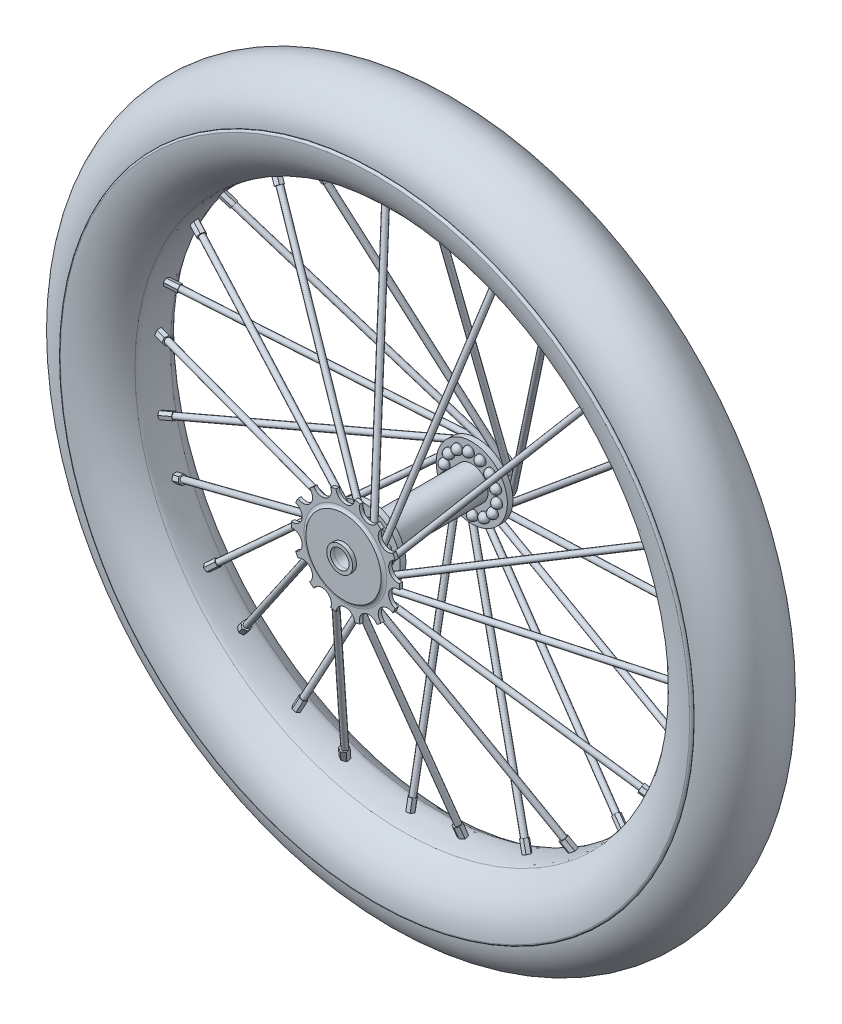
from build123d import *

# Parameters (mm, degrees)
BOSS_EXTRUDE1_DEPTH      = 38.1
BOSS_EXTRUDE1_DEPTH_BACK = 38.1
SKETCH2_R                = 8.89
SKETCH2_R_2              = 5.08
SKETCH3_R                = 5.08
BOSS_EXTRUDE2_DEPTH      = 3.81
SKETCH4_R                = 11.43
SKETCH4_R_2              = 5.08
BOSS_EXTRUDE3_DEPTH      = 3.81
SKETCH5_R                = 10.16
SKETCH5_R_2              = 5.08
BOSS_EXTRUDE4_DEPTH      = 3.81
FILLET1_R                = 2.54
SKETCH6_W                = 14.160332243
SKETCH6_H                = 3.048
SKETCH7_R                = 6.985
SKETCH7_R_2              = 5.08
BOSS_EXTRUDE5_DEPTH      = 2.032
SKETCH8_R                = 6.985
SKETCH8_R_2              = 5.08
BOSS_EXTRUDE6_DEPTH      = 6.35
SKETCH9_R                = 1.524
BOSS_EXTRUDE7_REACH      = 283.42
SKETCH10_R               = 2.54
BOSS_EXTRUDE8_DEPTH      = 6.35
CIRPATTERN1_COUNT        = 14
FILLET2_R                = 2.54
SKETCH12_R               = 1.524
BOSS_EXTRUDE10_REACH     = 283.544
SKETCH14_R               = 2.54
FILLET3_R                = 2.54
BOSS_EXTRUDE12_DEPTH     = 6.35
CIRPATTERN3_COUNT        = 14
FILLET3_OF_CIRPATTERN3_R = 2.54
SKETCH16_R               = 37.893444866
SKETCH16_R_2             = 20.32
CUT_EXTRUDE1_DEPTH       = 1.016
FILLET4_R                = 2.54
SKETCH17_R               = 37.893444866
SKETCH17_R_2             = 20.32
CUT_EXTRUDE2_DEPTH       = 1.016
FILLET5_R                = 2.54


# Some blends are built 0.0001 mm under size
with BuildPart() as part:
    # Sketch1 → Revolve1 (revolve)
    with BuildSketch(Plane(origin=(0, 0, 0), x_dir=(0, 0, -1), z_dir=(1, 0, 0)), mode=Mode.PRIVATE) as revolve1_sk:
        with BuildLine():
            ThreePointArc((-22.86, 170.18), (0, 193.04), (22.86, 170.18))
            ThreePointArc((22.86, 170.18), (23.876, 171.196), (24.892, 170.18))
            add(Edge.make_bspline(
                [(24.892, 170.18), (24.653803043, 159.198206923), (19.56957068, 150.819658721), (9.639302913, 145.044355395)],
                knots=[0, 0, 0, 0, 1, 1, 1, 1], degree=3))
            add(Edge.make_bspline(
                [(-9.639302913, 145.044355395), (-7.083077049, 143.557690576), (7.062484805, 143.545714418), (9.639302913, 145.044355395)],
                knots=[0, 0, 0, 0, 1, 1, 1, 1], degree=3))
            add(Edge.make_bspline(
                [(-24.892, 170.18), (-24.653803043, 159.198206923), (-19.56957068, 150.819658721), (-9.639302913, 145.044355395)],
                knots=[0, 0, 0, 0, 1, 1, 1, 1], degree=3))
            ThreePointArc((-24.892, 170.18), (-23.876, 171.196), (-22.86, 170.18))
        make_face()
    revolve(revolve1_sk.sketch.rotate(Axis((0, 0, 0), (0, 0, -1)), 90), axis=Axis((0, 0, 0), (0, 0, -1)))



with BuildPart() as body_2:
    # Sketch2 → Boss-Extrude1 (new, two sides: drawn at the far end of the back side and taken through both)
    with BuildSketch(Plane.XY.offset(-BOSS_EXTRUDE1_DEPTH_BACK)):
        Circle(SKETCH2_R)
        Circle(SKETCH2_R_2, mode=Mode.SUBTRACT)
    extrude(amount=BOSS_EXTRUDE1_DEPTH + BOSS_EXTRUDE1_DEPTH_BACK)

    # Sketch3 → Boss-Extrude2 (add)
    with BuildSketch(Plane.XY.offset(38.1)):
        with BuildLine():
            Line((5.060757507, -28.76826087), (7.922495633, -28.115087817))
            ThreePointArc((7.922495633, -28.115087817), (10.469614625, -21.740378782), (17.041665555, -23.723527037))
            ThreePointArc((17.041665555, -23.723527037), (18.212137112, -22.837297603), (19.336601349, -21.893376813))
            ThreePointArc((19.336601349, -21.893376813), (18.865593672, -15.044808919), (25.647262739, -13.980057726))
            ThreePointArc((25.647262739, -13.980057726), (26.317300631, -12.67374402), (26.92085602, -11.335414027))
            ThreePointArc((26.92085602, -11.335414027), (23.525010521, -5.369430136), (29.173104994, -1.467666527))
            ThreePointArc((29.173104994, -1.467666527), (29.21, 0), (29.173104994, 1.467666527))
            ThreePointArc((29.173104994, 1.467666527), (23.525010521, 5.369430136), (26.92085602, 11.335414027))
            ThreePointArc((26.92085602, 11.335414027), (26.317300631, 12.67374402), (25.647262739, 13.980057726))
            ThreePointArc((25.647262739, 13.980057726), (18.865593672, 15.044808919), (19.336601349, 21.893376813))
            ThreePointArc((19.336601349, 21.893376813), (18.212137112, 22.837297603), (17.041665555, 23.723527037))
            ThreePointArc((17.041665555, 23.723527037), (10.469614625, 21.740378782), (7.922495633, 28.115087817))
            ThreePointArc((7.922495633, 28.115087817), (6.499836481, 28.477644315), (5.060757507, 28.76826087))
            ThreePointArc((5.060757507, 28.76826087), (0, 24.13), (-5.060757507, 28.76826087))
            ThreePointArc((-5.060757507, 28.76826087), (-6.499836481, 28.477644315), (-7.922495633, 28.115087817))
            ThreePointArc((-7.922495633, 28.115087817), (-10.469614625, 21.740378782), (-17.041665555, 23.723527037))
            ThreePointArc((-17.041665555, 23.723527037), (-18.212137112, 22.837297603), (-19.336601349, 21.893376813))
            ThreePointArc((-19.336601349, 21.893376813), (-18.865593672, 15.044808919), (-25.647262739, 13.980057726))
            ThreePointArc((-25.647262739, 13.980057726), (-26.317300631, 12.67374402), (-26.92085602, 11.335414027))
            ThreePointArc((-26.92085602, 11.335414027), (-23.525010521, 5.369430136), (-29.173104994, 1.467666527))
            ThreePointArc((-29.173104994, 1.467666527), (-29.21, 0), (-29.173104994, -1.467666527))
            ThreePointArc((-29.173104994, -1.467666527), (-23.525010521, -5.369430136), (-26.92085602, -11.335414027))
            ThreePointArc((-26.92085602, -11.335414027), (-26.317300631, -12.67374402), (-25.647262739, -13.980057726))
            ThreePointArc((-25.647262739, -13.980057726), (-18.865593672, -15.044808919), (-19.336601349, -21.893376813))
            ThreePointArc((-19.336601349, -21.893376813), (-18.212137112, -22.837297603), (-17.041665555, -23.723527037))
            ThreePointArc((-17.041665555, -23.723527037), (-10.469614625, -21.740378782), (-7.922495633, -28.115087817))
            ThreePointArc((-7.922495633, -28.115087817), (-6.499836481, -28.477644315), (-5.060757507, -28.76826087))
            ThreePointArc((-5.060757507, -28.76826087), (0, -24.13), (5.060757507, -28.76826087))
        make_face()
        Circle(SKETCH3_R, mode=Mode.SUBTRACT)
    extrude(amount=BOSS_EXTRUDE2_DEPTH)

    # Sketch4 → Boss-Extrude3 (add)
    with BuildSketch(Plane(origin=(0, 0, 38.1), x_dir=(-1, 0, 0), z_dir=(0, 0, -1))):
        with Locations(Location((0, 0, 0), (0, 0, 180))):
            Circle(SKETCH4_R)
        with Locations(Location((0, 0, 0), (0, 0, 180))):
            Circle(SKETCH4_R_2, mode=Mode.SUBTRACT)
    boss_extrude3 = extrude(amount=BOSS_EXTRUDE3_DEPTH)

    # Sketch5 → Boss-Extrude4 (add)
    with BuildSketch(Plane(origin=(0, 0, 34.29), x_dir=(-1, 0, 0), z_dir=(0, 0, -1))):
        with Locations(Location((0, 0, 0), (0, 0, 180))):
            Circle(SKETCH5_R)
        with Locations(Location((0, 0, 0), (0, 0, 180))):
            Circle(SKETCH5_R_2, mode=Mode.SUBTRACT)
    boss_extrude4 = extrude(amount=BOSS_EXTRUDE4_DEPTH)

    # Mirror1: Boss-Extrude3, Boss-Extrude4 across plane
    add(boss_extrude3.mirror(Plane.XY))
    add(boss_extrude4.mirror(Plane.XY))

    # Fillet1
    # the kernel refuses this fillet: 2.54 mm, written as the material it adds along each edge
    with BuildSketch(Plane(origin=(0, 0, -34.29), x_dir=(1, 0, 0), z_dir=(0, 1, 0))) as fillet1_piece_1:
        with BuildLine():
            CenterArc((12.7, -2.199704526), FILLET1_R, 120, 60)
            Line((11.43, 0), (11.4046, 0.043994091))
            ThreePointArc((11.4046, 0.043994091), (10.795, 0.0508), (10.16, 0.0508))
            Line((10.16, 0.0508), (10.1092, 0))
            Line((10.1092, 0), (10.1092, -2.199704526))
            Line((10.1092, -2.199704526), (10.16, -2.199704526))
        make_face()
    revolve(axis=Axis((0, 0, -34.29), (0, 0, -1)))
    with BuildSketch(Plane(origin=(0, 0, 34.29), x_dir=(1, 0, 0), z_dir=(0, 1, 0))) as fillet1_piece_2:
        with BuildLine():
            CenterArc((12.7, 2.199704526), FILLET1_R, 180, 60)
            Line((11.43, 0), (11.4046, -0.043994091))
            ThreePointArc((11.4046, -0.043994091), (10.795, -0.0508), (10.16, -0.0508))
            Line((10.16, -0.0508), (10.1092, 0))
            Line((10.1092, 0), (10.1092, 2.199704526))
            Line((10.1092, 2.199704526), (10.16, 2.199704526))
        make_face()
    revolve(axis=Axis((0, 0, 34.29), (0, 0, -1)))

    # Sketch6 → Revolve2 (revolve)
    with BuildSketch(Plane(origin=(0, 0, 0), x_dir=(1, 0, 0), z_dir=(0, 1, 0))):
        with Locations((-12.160166122, 28.956)):
            Rectangle(SKETCH6_W, SKETCH6_H)
        with Locations((-12.160166122, -28.956)):
            Rectangle(SKETCH6_W, SKETCH6_H)
    revolve(axis=Axis((0, 0, -38.1), (0, 0, 1)))


with BuildPart() as body_3:
    # Sketch7 → Boss-Extrude5 (new body)
    with BuildSketch(Plane.XY.offset(41.91)):
        Circle(SKETCH7_R)
        Circle(SKETCH7_R_2, mode=Mode.SUBTRACT)
    extrude(amount=BOSS_EXTRUDE5_DEPTH)


with BuildPart() as body_4:
    # Sketch8 → Boss-Extrude6 (new body)
    with BuildSketch(Plane(origin=(0, 0, -38.1), x_dir=(-1, 0, 0), z_dir=(0, 0, -1))):
        Circle(SKETCH8_R)
        Circle(SKETCH8_R_2, mode=Mode.SUBTRACT)
    extrude(amount=BOSS_EXTRUDE6_DEPTH)


with BuildPart() as part_1:
    add(part.part)

    add(body_2.part)  # Sweep1 merges body 2
    # Sweep1: sweep along a curve in space
    with BuildLine() as sweep1_path:
        Line((-4.843776069, 14.957865584, -34.126089018), (-138.745661837, 38.278047733, -0.782106505))
        ThreePointArc((-4.843776069, 14.957865584, -34.126089018), (-2.275159795, 14.510518641, -33.564180716), (-1.125527161, 14.310300083, -31.165867325))
        Line((-1.125527161, 14.310300083, -27.432), (-1.125527161, 14.310300083, -31.165867325))
        Line((-1.125527161, 14.310300083, -27.432), (-1.125527161, 14.310300083, -24.384))
    # Sketch9 → Sweep1 (sweep)
    with BuildSketch(Plane(origin=(-138.745661837, 38.278047733, -0.782106505), x_dir=(0.23472706741246765, -0.0408797675689433, 0.9712013428879988), z_dir=(-0.9567992703776121, 0.1666349442113543, 0.23826026016217636))):
        Circle(SKETCH9_R)
    sweep1 = sweep(path=sweep1_path.line)

    # Sketch10 → Boss-Extrude7 (add, up to next)
    with BuildSketch(Plane.XY.offset(-24.384), mode=Mode.PRIVATE) as boss_extrude7_sk1:
        with Locations((-1.125527161, 14.310300083)):
            Circle(SKETCH10_R)
    boss_extrude7_tool1 = extrude(boss_extrude7_sk1.sketch, amount=-BOSS_EXTRUDE7_REACH, mode=Mode.PRIVATE) - part_1.part
    boss_extrude7 = boss_extrude7_tool1.solids().sort_by_distance((-1.125527, 14.3103, -24.384))[0]
    add(boss_extrude7)


with BuildPart() as body_4_2:
    # Sketch11 → Boss-Extrude8 (new body)
    with BuildSketch(Plane(origin=(-138.745661837, 38.278047733, -0.782106505), x_dir=(0.23472706741246765, -0.0408797675689433, 0.9712013428879988), z_dir=(-0.9567992703776121, 0.1666349442113543, 0.23826026016217636))):
        Polygon((-0.340783466, -2.003220065), (1.564447733, -1.296737171), (1.905231199, 0.706482894), (0.340783466, 2.003220065), (-1.564447733, 1.296737171), (-1.905231199, -0.706482894), align=None)
    boss_extrude8 = extrude(amount=-BOSS_EXTRUDE8_DEPTH)


with BuildPart() as part_2:
    add(part_1.part)

    # CirPattern1: Sweep1, Boss-Extrude7, Boss-Extrude8 ×14 about axis
    cirpattern1_axis = Axis((0, 0, 0), (0, 0, 1))
    add([sweep1.rotate(cirpattern1_axis, i * 360 / CIRPATTERN1_COUNT) for i in range(1, CIRPATTERN1_COUNT)])
    add([boss_extrude7.rotate(cirpattern1_axis, i * 360 / CIRPATTERN1_COUNT) for i in range(1, CIRPATTERN1_COUNT)])
    add([boss_extrude8.rotate(cirpattern1_axis, i * 360 / CIRPATTERN1_COUNT) for i in range(1, CIRPATTERN1_COUNT)])

    # Fillet2
    fillet2_edges = [part_2.edges().sort_by_distance(p)[0] for p in [
        (14.76716751, 0.389283402, -24.384),
        (13.473661931, -6.056501629, -24.384),
        (9.511532364, -11.302722235, -24.384),
        (3.665527161, -14.310300083, -24.384),
        (-2.906480652, -14.483547495, -24.384),
        (-8.902824325, -11.788150697, -24.384),
        (-13.135854455, -6.757966081, -24.384),
        (-14.76716751, -0.389283402, -24.384),
        (-13.473661931, 6.056501629, -24.384),
        (-9.511532364, 11.302722235, -24.384),
        (-3.665527161, 14.310300083, -24.384),
        (2.906480652, 14.483547495, -24.384),
        (8.902824325, 11.788150697, -24.384),
        (13.135854455, 6.757966081, -24.384),
    ]]
    fillet(fillet2_edges, radius=FILLET2_R - 0.0001)  # a hair under: the kernel refuses the full size

    # Sweep3: sweep along a curve in space
    with BuildLine() as sweep3_path:
        Line((13.813011478, 9.061857251, 33.994717988), (42.977234575, 137.391375094, -2.105123238))
        ThreePointArc((12.958857902, 5.30337837, 31.055302978), (13.22471615, 6.473217894, 33.478931582), (13.813011478, 9.061857251, 33.994717988))
        Line((12.958857902, 5.30337837, 27.432), (12.958857902, 5.30337837, 31.055302978))
        Line((12.958857902, 5.30337837, 27.432), (12.958857902, 5.30337837, 24.384))
    # Sketch12 → Sweep3 (sweep)
    with BuildSketch(Plane(origin=(42.977234575, 137.391375094, -2.105123238), x_dir=(0.9768674105714977, -0.20779848196263315, 0.05049606972193202), z_dir=(0.21371486792608066, 0.9403962473294285, -0.26453894464911265))):
        Circle(SKETCH12_R)
    sweep3 = sweep(path=sweep3_path.line)

    # Sketch14 → Boss-Extrude10 (add, up to next)
    with BuildSketch(Plane(origin=(0, 0, 24.384), x_dir=(-1, 0, 0), z_dir=(0, 0, -1)), mode=Mode.PRIVATE) as boss_extrude10_sk1:
        with Locations(Location((-12.958857902, 5.30337837, 0), (0, 0, 90))):
            Circle(SKETCH14_R)
    boss_extrude10_tool1 = extrude(boss_extrude10_sk1.sketch, amount=-BOSS_EXTRUDE10_REACH, mode=Mode.PRIVATE) - part_2.part
    boss_extrude10 = boss_extrude10_tool1.solids().sort_by_distance((12.958858, 5.303378, 24.384))[0]
    add(boss_extrude10)

    # Fillet3
    fillet3_edges = [part_2.edges().sort_by_distance(p)[0] for p in [
        (12.958857902, 2.76337837, 24.384),
    ]]
    fillet(fillet3_edges, radius=FILLET3_R)

    # Sketch15 → Boss-Extrude12 (add)
    with BuildSketch(Plane(origin=(42.977234575, 137.391375094, -2.105123238), x_dir=(0.9768674105714977, -0.20779848196263315, 0.05049606972193202), z_dir=(0.21371486792608066, 0.9403962473294285, -0.26453894464911265))):
        Polygon((-1.964597547, -1.283816425), (-0.016390643, -2.505370139), (2.015609357, -1.428950325), (2.099402453, 0.869023203), (0.151195549, 2.090576916), (-1.880804451, 1.014157102), align=None)
    boss_extrude12 = extrude(amount=-BOSS_EXTRUDE12_DEPTH)

    # CirPattern3: Sweep3, Boss-Extrude10, Boss-Extrude12 ×14 about axis
    cirpattern3_axis = Axis((0, 0, 0), (0, 0, 1))
    add([sweep3.rotate(cirpattern3_axis, i * 360 / CIRPATTERN3_COUNT) for i in range(1, CIRPATTERN3_COUNT)])
    add([boss_extrude10.rotate(cirpattern3_axis, i * 360 / CIRPATTERN3_COUNT) for i in range(1, CIRPATTERN3_COUNT)])
    add([boss_extrude12.rotate(cirpattern3_axis, i * 360 / CIRPATTERN3_COUNT) for i in range(1, CIRPATTERN3_COUNT)])

    # Fillet3 of CirPattern3
    fillet3_of_cirpattern3_edges = [part_2.edges().sort_by_distance(p)[0] for p in [
        (10.476542593, 8.112355602, 24.384),
        (5.919219538, 11.854581316, 24.384),
        (0.189522459, 13.248861814, 24.384),
        (-5.577711868, 12.019042743, 24.384),
        (-10.240211953, 8.408704852, 24.384),
        (-12.874512473, 3.13291984, 24.384),
        (-12.958857902, -2.76337837, 24.384),
        (-10.476542593, -8.112355602, 24.384),
        (-5.919219538, -11.854581316, 24.384),
        (-0.189522459, -13.248861814, 24.384),
        (5.577711868, -12.019042743, 24.384),
        (10.240211953, -8.408704852, 24.384),
        (12.874512473, -3.13291984, 24.384),
    ]]
    fillet(fillet3_of_cirpattern3_edges, radius=FILLET3_OF_CIRPATTERN3_R)

    # Sketch16 → Cut-Extrude1 (cut)
    with BuildSketch(Plane.XY.offset(41.91)):
        Circle(SKETCH16_R)
        Circle(SKETCH16_R_2, mode=Mode.SUBTRACT)
    extrude(amount=-CUT_EXTRUDE1_DEPTH, mode=Mode.SUBTRACT)

    # Fillet4
    # the kernel refuses this fillet: 2.54 mm, written as the material it adds along each edge
    with BuildSketch(Plane(origin=(0, 0, 40.894), x_dir=(1, 0, 0), z_dir=(0, -1, 0))) as fillet4_piece_1:
        with BuildLine():
            CenterArc((22.352, 2.54), FILLET4_R, 216.869897646, 53.130102354)
            Line((20.32, 1.016), (20.27936, 0.98552))
            ThreePointArc((20.27936, 0.98552), (20.2692, 0.508), (20.2692, 0))
            Line((20.2692, 0), (20.32, -0.0508))
            Line((20.32, -0.0508), (22.352, -0.0508))
            Line((22.352, -0.0508), (22.352, 0))
        make_face()
    revolve(axis=Axis((0, 0, 40.894), (0, 0, 1)))

    # Sketch17 → Cut-Extrude2 (cut)
    with BuildSketch(Plane(origin=(0, 0, 38.1), x_dir=(-1, 0, 0), z_dir=(0, 0, -1))):
        Circle(SKETCH17_R)
        Circle(SKETCH17_R_2, mode=Mode.SUBTRACT)
    extrude(amount=-CUT_EXTRUDE2_DEPTH, mode=Mode.SUBTRACT)

    # Fillet5
    # the kernel refuses this fillet: 2.54 mm, written as the material it takes off along each edge
    with BuildSketch(Plane(origin=(0, 0, 38.1), x_dir=(-1, 0, 0), z_dir=(0, -1, 0))) as fillet5_piece_1:
        with BuildLine():
            CenterArc((18.288, -2.54), FILLET5_R, 36.869897646, 53.130102354)
            Line((18.288, 0), (18.288, 0.0508))
            Line((18.288, 0.0508), (20.32, 0.0508))
            Line((20.32, 0.0508), (20.3708, 0))
            ThreePointArc((20.3708, 0), (20.3708, -0.508), (20.36064, -0.98552))
            Line((20.36064, -0.98552), (20.32, -1.016))
        make_face()
    revolve(axis=Axis((0, 0, 38.1), (0, 0, -1)), mode=Mode.SUBTRACT)


solid = Compound([body_3.part, body_4.part, body_4_2.part, part_2.part])
